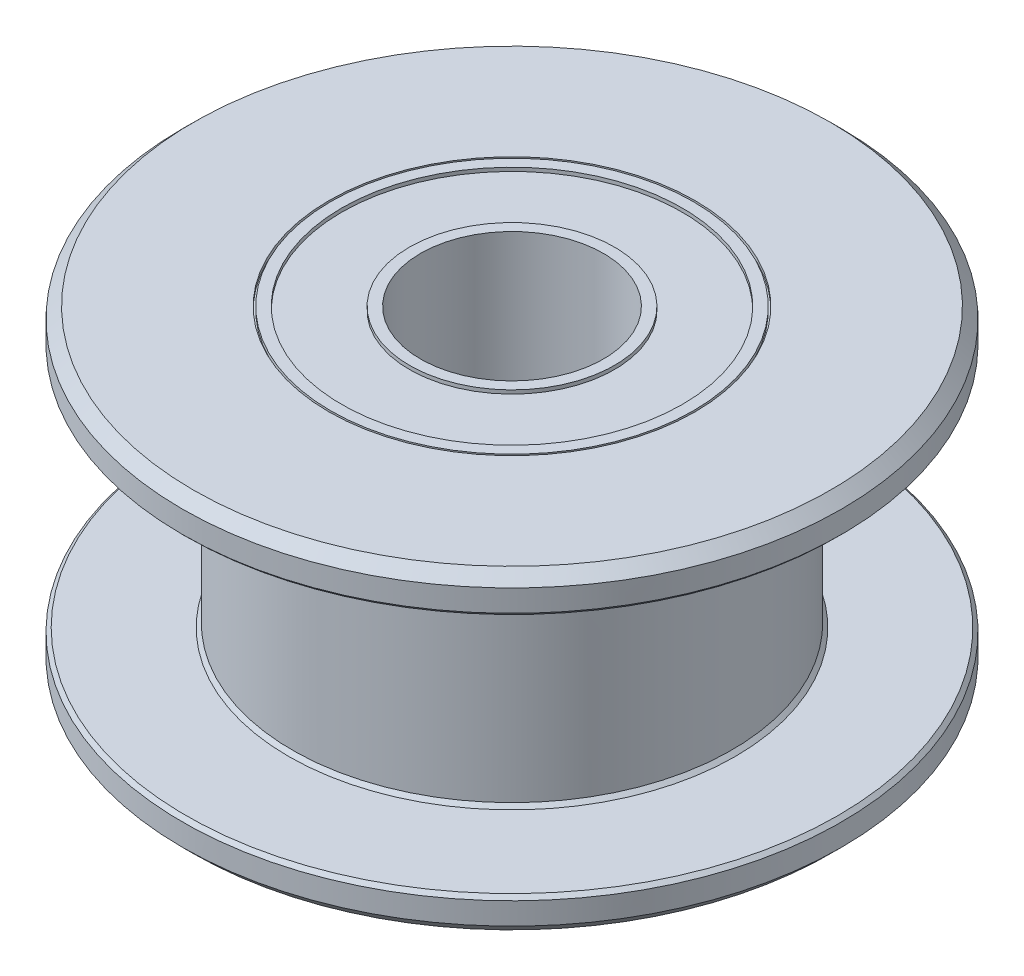
from build123d import *

# Parameters (mm, degrees)
CHAFL_N3_SIZE = 0.3
CHAFL_N4_SIZE = 0.1


with BuildPart() as part:
    # Croquis1 → Revolución3 (revolve)
    with BuildSketch(Plane.XY):
        Polygon((6.5, -20.750745615), (2.5, -20.750745615), (2.5, -20.850745615), (2.45, -20.850745615), (2.45, -20.750745615), (2.15, -20.750745615), (2.15, -20.850745615), (0.3, -20.850745615), (0.3, -20.750745615), (0, -20.750745615), (0, -20.850745615), (0, -29.250745615), (1.690218344, -29.250745615), (1.690218344, -29.350745615), (6.5, -29.350745615), (6.5, -28.350745615), (3.5, -28.350745615), (3.5, -21.750745615), (6.5, -21.750745615), align=None)
    revolve(axis=Axis((-2.5, -20.750745615, 0), (0, -1, 0)))

    # Chaflán3
    chafl_n3_edges = [part.edges().sort_by_distance(p)[0] for p in [
        (-11.5, -29.350745615, 0),
        (-11.5, -20.750745615, 0),
    ]]
    chamfer(chafl_n3_edges, length=CHAFL_N3_SIZE)

    # Chaflán4
    chafl_n4_edges = [part.edges().sort_by_distance(p)[0] for p in [
        (-11.5, -28.350745615, 0),
        (-8.5, -28.350745615, 0),
        (-11.5, -21.750745615, 0),
    ]]
    chamfer(chafl_n4_edges, length=CHAFL_N4_SIZE)


solid = part.part
